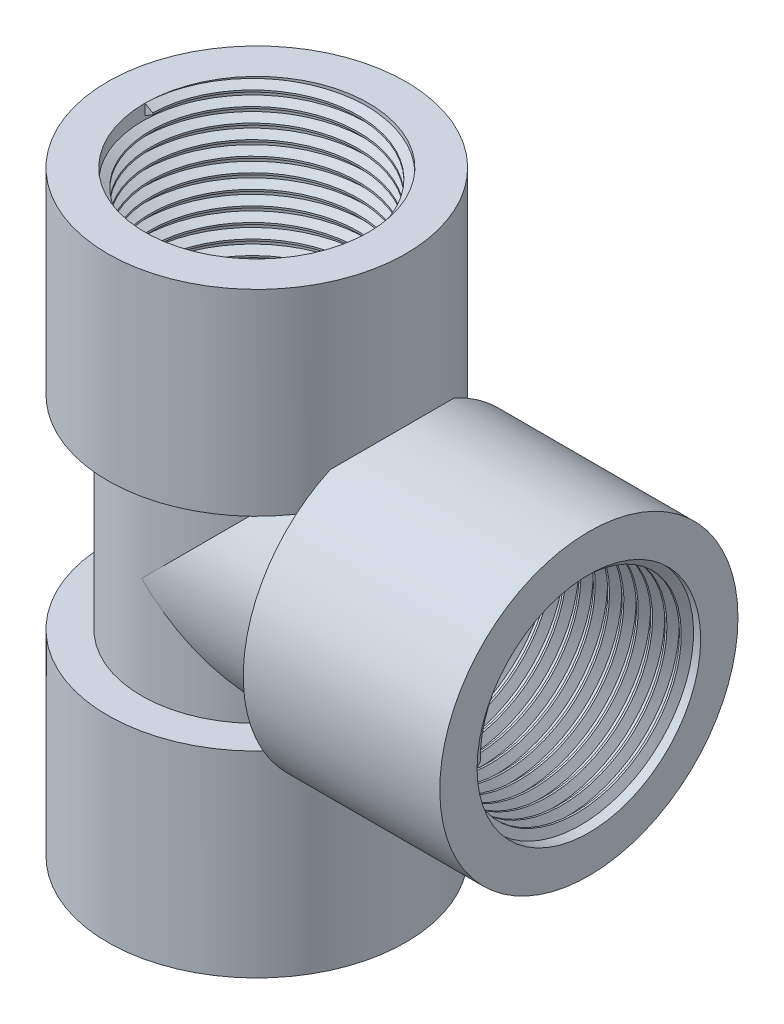
from build123d import *
from build123d.topology import SkipClean

# Parameters (mm, degrees)
SZKIC1_R                        = 17
SZKIC1_R_2                      = 12.5
DODANIE_WYCI_GNI_CIE1_DEPTH     = 30
SZKIC4_R                        = 17
SZKIC4_R_2                      = 12.5
DODANIE_WYCI_GNI_CIE3_DEPTH     = 20
WYTNIJ_WYCI_GNI_CIE1_DEPTH      = 20
WYTNIJ_WYCI_GNI_CIE1_DEPTH_BACK = 42.38840434
SZKIC5_R                        = 12.5
WYTNIJ_WYCI_GNI_CIE2_REACH      = 53.788
SZKIC6_R                        = 12.5
SZKIC7_R                        = 22
SZKIC7_R_2                      = 16.5
DODANIE_WYCI_GNI_CIE4_DEPTH     = 29
DODANIE_WYCI_GNI_CIE5_START     = 29
SZKIC8_R                        = 22
SZKIC8_R_2                      = 16.5
DODANIE_WYCI_GNI_CIE5_DEPTH     = 29
SZKIC9_R                        = 22
SZKIC9_R_2                      = 16.5
DODANIE_WYCI_GNI_CIE6_DEPTH     = 29
GWINT1_PITCH                    = 2.116666667
GWINT2_PITCH                    = 2.116666667
GWINT3_PITCH                    = 2.116666667


with BuildPart() as part:
    # Szkic1 → Dodanie-wyciągnięcie1 (new body)
    with BuildSketch(Plane(origin=(0, 0, 0), x_dir=(1, 0, 0), z_dir=(0, 1, 0))):
        with Locations(Location((0, 0, 0), (0, 0, 270))):
            Circle(SZKIC1_R)
        with Locations(Location((0, 0, 0), (0, 0, 270))):
            Circle(SZKIC1_R_2, mode=Mode.SUBTRACT)
    extrude(amount=DODANIE_WYCI_GNI_CIE1_DEPTH)

    # Szkic4 → Dodanie-wyciągnięcie3 (add)
    with BuildSketch(Plane(origin=(20, 0, 0), x_dir=(0, 0, -1), z_dir=(1, 0, 0))):
        with Locations((0, 15)):
            Circle(SZKIC4_R)
        with Locations((0, 15)):
            Circle(SZKIC4_R_2, mode=Mode.SUBTRACT)
    extrude(amount=-DODANIE_WYCI_GNI_CIE3_DEPTH)

    # Szkic5 → Wytnij-wyciągnięcie1 (cut, two sides: drawn at the far end of the back side and taken through both)
    with BuildSketch(Plane(origin=(0, 30, 0), x_dir=(1, 0, 0), z_dir=(0, 1, 0)).offset(-WYTNIJ_WYCI_GNI_CIE1_DEPTH_BACK)):
        with Locations(Location((0, 0, 0), (0, 0, 320.2081805))):
            Circle(SZKIC5_R)
    extrude(amount=WYTNIJ_WYCI_GNI_CIE1_DEPTH + WYTNIJ_WYCI_GNI_CIE1_DEPTH_BACK, mode=Mode.SUBTRACT)

    # Szkic6 → Wytnij-wyciągnięcie2 (cut, up to next)
    with BuildSketch(Plane(origin=(20, 0, 0), x_dir=(0, 0, -1), z_dir=(1, 0, 0)), mode=Mode.PRIVATE) as wytnij_wyci_gni_cie2_sk1:
        with Locations((0, 15)):
            Circle(SZKIC6_R)
    wytnij_wyci_gni_cie2_tool1 = extrude(wytnij_wyci_gni_cie2_sk1.sketch, amount=-WYTNIJ_WYCI_GNI_CIE2_REACH, mode=Mode.PRIVATE) & part.part
    add(wytnij_wyci_gni_cie2_tool1.solids().sort_by_distance((20, 15, 0))[0], mode=Mode.SUBTRACT)

    # Szkic7 → Dodanie-wyciągnięcie4 (add)
    with BuildSketch(Plane.XZ):
        with Locations(Location((0, 0, 0), (0, 0, 90))):
            Circle(SZKIC7_R)
        with Locations(Location((0, 0, 0), (0, 0, 29.002546027))):
            Circle(SZKIC7_R_2, mode=Mode.SUBTRACT)
    extrude(amount=DODANIE_WYCI_GNI_CIE4_DEPTH)

    # Szkic8 → Dodanie-wyciągnięcie5 (add)
    with BuildSketch(Plane(origin=(0, 30, 0), x_dir=(1, 0, 0), z_dir=(0, 1, 0)).offset(DODANIE_WYCI_GNI_CIE5_START)):
        with Locations(Location((0, 0, 0), (0, 0, 270))):
            Circle(SZKIC8_R)
        with Locations(Location((0, 0, 0), (0, 0, 330.997453973))):
            Circle(SZKIC8_R_2, mode=Mode.SUBTRACT)
    extrude(amount=-DODANIE_WYCI_GNI_CIE5_DEPTH)

    # Szkic9 → Dodanie-wyciągnięcie6 (add)
    with BuildSketch(Plane(origin=(20, 0, 0), x_dir=(0, 0, -1), z_dir=(1, 0, 0))):
        with Locations(Location((0, 15, 0), (0, 0, 245.380022671))):
            Circle(SZKIC9_R)
        with Locations(Location((0, 15, 0), (0, 0, 114.619977329))):
            Circle(SZKIC9_R_2, mode=Mode.SUBTRACT)
    extrude(amount=DODANIE_WYCI_GNI_CIE6_DEPTH)

    # Gwint1: arcs per turn and ends read off the stored shape
    # Gwint1: the profile of Profil gwintu1 profile screwed along a right-hand helix through 13.700787 turns, 10 arcs to a turn; built about Z, then put on its axis
    with SkipClean():  # the faces are left unmerged after this step: merging them gives an invalid solid
        gwint1_z = Axis((0, 0, 0), (0, 0, 1))
        gwint1_corners = [(16.5003, 0, -0.000173205), (15.354320565, 0, 0.66145833), (15.354320565, 0, 0.926041664), (16.5003, 0, 1.587673199)]
        with BuildLine(mode=Mode.PRIVATE) as gwint1_profile:
            Line(gwint1_corners[0], gwint1_corners[1])
            Line(gwint1_corners[1], gwint1_corners[2])
            Line(gwint1_corners[2], gwint1_corners[3])
            Line(gwint1_corners[3], gwint1_corners[0])
        gwint1_cap = Face(gwint1_profile.wire())
        gwint1_turn_angles = [0, 18, 36, 54, 72, 90, 108, 126, 144, 162, 180, 198, 216, 234, 252, 270, 288, 306, 324, 342, 360]
        gwint1_turn_weights = [1, 0.9510565162951535, 1, 0.9510565162951535, 1, 0.9510565162951535, 1, 0.9510565162951535, 1, 0.9510565162951535, 1, 0.9510565162951535, 1, 0.9510565162951535, 1, 0.9510565162951535, 1, 0.9510565162951535, 1, 0.9510565162951535, 1]
        gwint1_turn_rails = [Edge.make_bspline([Vector(p[0], p[1], 0).rotate(gwint1_z, gwint1_turn_angles[k]) / gwint1_turn_weights[k] + Vector(0, 0, p[2] + GWINT1_PITCH * gwint1_turn_angles[k] / 360) for k in range(21)], [0, 0, 0, 1, 1, 2, 2, 3, 3, 4, 4, 5, 5, 6, 6, 7, 7, 8, 8, 9, 9, 10, 10, 10], 2, gwint1_turn_weights) for p in gwint1_corners]
        gwint1_turn_sides = [Face.make_surface_from_curves(gwint1_turn_rails[p[0]], gwint1_turn_rails[p[1]]) for p in [(0, 1), (1, 2), (2, 3), (3, 0)]]
        gwint1_last_angles = [4680, 4698, 4716, 4734, 4752, 4770, 4788, 4806, 4824, 4842, 4860, 4878, 4896, 4914, 4932, 4932.141732283, 4932.283464567]
        gwint1_last_weights = [1, 0.9510565162951535, 1, 0.9510565162951535, 1, 0.9510565162951535, 1, 0.9510565162951535, 1, 0.9510565162951535, 1, 0.9510565162951535, 1, 0.9510565162951535, 1, 0.9999969404180766, 1]
        gwint1_last_rails = [Edge.make_bspline([Vector(p[0], p[1], 0).rotate(gwint1_z, gwint1_last_angles[k]) / gwint1_last_weights[k] + Vector(0, 0, p[2] + GWINT1_PITCH * gwint1_last_angles[k] / 360) for k in range(17)], [0, 0, 0, 1, 1, 2, 2, 3, 3, 4, 4, 5, 5, 6, 6, 7, 7, 8, 8, 8], 2, gwint1_last_weights) for p in gwint1_corners]
        gwint1_last_sides = [Face.make_surface_from_curves(gwint1_last_rails[p[0]], gwint1_last_rails[p[1]]) for p in [(0, 1), (1, 2), (2, 3), (3, 0)]]
        gwint1 = Plane(origin=(0, 59, 0), x_dir=(-1, 0, 0), z_dir=(0, -1, 0)) * Solid(Shell([*[p.moved(Location((0, 0, GWINT1_PITCH * i))) for i in range(13) for p in gwint1_turn_sides], *gwint1_last_sides, gwint1_cap, gwint1_cap.rotate(gwint1_z, 4932.283464567).moved(Location((0, 0, GWINT1_PITCH * 4932.283464567 / 360)))]))
        add(gwint1)

    # Gwint2: arcs per turn and ends read off the stored shape
    # Gwint2: the profile of Profil gwintu2 profile screwed along a right-hand helix through 13.700787 turns, 10 arcs to a turn; built about Z, then put on its axis
    with SkipClean():  # the faces are left unmerged after this step: merging them gives an invalid solid
        gwint2_z = Axis((0, 0, 0), (0, 0, 1))
        gwint2_corners = [(16.5003, 0, -0.000173205), (15.354320565, 0, 0.66145833), (15.354320565, 0, 0.926041664), (16.5003, 0, 1.587673199)]
        with BuildLine(mode=Mode.PRIVATE) as gwint2_profile:
            Line(gwint2_corners[0], gwint2_corners[1])
            Line(gwint2_corners[1], gwint2_corners[2])
            Line(gwint2_corners[2], gwint2_corners[3])
            Line(gwint2_corners[3], gwint2_corners[0])
        gwint2_cap = Face(gwint2_profile.wire())
        gwint2_turn_angles = [0, 18, 36, 54, 72, 90, 108, 126, 144, 162, 180, 198, 216, 234, 252, 270, 288, 306, 324, 342, 360]
        gwint2_turn_weights = [1, 0.9510565162951535, 1, 0.9510565162951535, 1, 0.9510565162951535, 1, 0.9510565162951535, 1, 0.9510565162951535, 1, 0.9510565162951535, 1, 0.9510565162951535, 1, 0.9510565162951535, 1, 0.9510565162951535, 1, 0.9510565162951535, 1]
        gwint2_turn_rails = [Edge.make_bspline([Vector(p[0], p[1], 0).rotate(gwint2_z, gwint2_turn_angles[k]) / gwint2_turn_weights[k] + Vector(0, 0, p[2] + GWINT2_PITCH * gwint2_turn_angles[k] / 360) for k in range(21)], [0, 0, 0, 1, 1, 2, 2, 3, 3, 4, 4, 5, 5, 6, 6, 7, 7, 8, 8, 9, 9, 10, 10, 10], 2, gwint2_turn_weights) for p in gwint2_corners]
        gwint2_turn_sides = [Face.make_surface_from_curves(gwint2_turn_rails[p[0]], gwint2_turn_rails[p[1]]) for p in [(0, 1), (1, 2), (2, 3), (3, 0)]]
        gwint2_last_angles = [4680, 4698, 4716, 4734, 4752, 4770, 4788, 4806, 4824, 4842, 4860, 4878, 4896, 4914, 4932, 4932.141732283, 4932.283464567]
        gwint2_last_weights = [1, 0.9510565162951535, 1, 0.9510565162951535, 1, 0.9510565162951535, 1, 0.9510565162951535, 1, 0.9510565162951535, 1, 0.9510565162951535, 1, 0.9510565162951535, 1, 0.9999969404180766, 1]
        gwint2_last_rails = [Edge.make_bspline([Vector(p[0], p[1], 0).rotate(gwint2_z, gwint2_last_angles[k]) / gwint2_last_weights[k] + Vector(0, 0, p[2] + GWINT2_PITCH * gwint2_last_angles[k] / 360) for k in range(17)], [0, 0, 0, 1, 1, 2, 2, 3, 3, 4, 4, 5, 5, 6, 6, 7, 7, 8, 8, 8], 2, gwint2_last_weights) for p in gwint2_corners]
        gwint2_last_sides = [Face.make_surface_from_curves(gwint2_last_rails[p[0]], gwint2_last_rails[p[1]]) for p in [(0, 1), (1, 2), (2, 3), (3, 0)]]
        gwint2 = Plane(origin=(0, -29, 0), x_dir=(1, 0, 0), z_dir=(0, 1, 0)) * Solid(Shell([*[p.moved(Location((0, 0, GWINT2_PITCH * i))) for i in range(13) for p in gwint2_turn_sides], *gwint2_last_sides, gwint2_cap, gwint2_cap.rotate(gwint2_z, 4932.283464567).moved(Location((0, 0, GWINT2_PITCH * 4932.283464567 / 360)))]))
        add(gwint2)

    # Gwint3: arcs per turn and ends read off the stored shape
    # Gwint3: the profile of Profil gwintu3 profile screwed along a right-hand helix through 13.700787 turns, 10 arcs to a turn; built about Z, then put on its axis
    with SkipClean():  # the faces are left unmerged after this step: merging them gives an invalid solid
        gwint3_z = Axis((0, 0, 0), (0, 0, 1))
        gwint3_corners = [(16.5003, 0, -0.000173205), (15.354320565, 0, 0.66145833), (15.354320565, 0, 0.926041664), (16.5003, 0, 1.587673199)]
        with BuildLine(mode=Mode.PRIVATE) as gwint3_profile:
            Line(gwint3_corners[0], gwint3_corners[1])
            Line(gwint3_corners[1], gwint3_corners[2])
            Line(gwint3_corners[2], gwint3_corners[3])
            Line(gwint3_corners[3], gwint3_corners[0])
        gwint3_cap = Face(gwint3_profile.wire())
        gwint3_turn_angles = [0, 18, 36, 54, 72, 90, 108, 126, 144, 162, 180, 198, 216, 234, 252, 270, 288, 306, 324, 342, 360]
        gwint3_turn_weights = [1, 0.9510565162951535, 1, 0.9510565162951535, 1, 0.9510565162951535, 1, 0.9510565162951535, 1, 0.9510565162951535, 1, 0.9510565162951535, 1, 0.9510565162951535, 1, 0.9510565162951535, 1, 0.9510565162951535, 1, 0.9510565162951535, 1]
        gwint3_turn_rails = [Edge.make_bspline([Vector(p[0], p[1], 0).rotate(gwint3_z, gwint3_turn_angles[k]) / gwint3_turn_weights[k] + Vector(0, 0, p[2] + GWINT3_PITCH * gwint3_turn_angles[k] / 360) for k in range(21)], [0, 0, 0, 1, 1, 2, 2, 3, 3, 4, 4, 5, 5, 6, 6, 7, 7, 8, 8, 9, 9, 10, 10, 10], 2, gwint3_turn_weights) for p in gwint3_corners]
        gwint3_turn_sides = [Face.make_surface_from_curves(gwint3_turn_rails[p[0]], gwint3_turn_rails[p[1]]) for p in [(0, 1), (1, 2), (2, 3), (3, 0)]]
        gwint3_turn = Solid(Shell([*gwint3_turn_sides, gwint3_cap, gwint3_cap.rotate(gwint3_z, 360).moved(Location((0, 0, GWINT3_PITCH * 360 / 360)))]))
        gwint3_last_angles = [4680, 4698, 4716, 4734, 4752, 4770, 4788, 4806, 4824, 4842, 4860, 4878, 4896, 4914, 4932, 4932.141732283, 4932.283464567]
        gwint3_last_weights = [1, 0.9510565162951535, 1, 0.9510565162951535, 1, 0.9510565162951535, 1, 0.9510565162951535, 1, 0.9510565162951535, 1, 0.9510565162951535, 1, 0.9510565162951535, 1, 0.9999969404180766, 1]
        gwint3_last_rails = [Edge.make_bspline([Vector(p[0], p[1], 0).rotate(gwint3_z, gwint3_last_angles[k]) / gwint3_last_weights[k] + Vector(0, 0, p[2] + GWINT3_PITCH * gwint3_last_angles[k] / 360) for k in range(17)], [0, 0, 0, 1, 1, 2, 2, 3, 3, 4, 4, 5, 5, 6, 6, 7, 7, 8, 8, 8], 2, gwint3_last_weights) for p in gwint3_corners]
        gwint3_last_sides = [Face.make_surface_from_curves(gwint3_last_rails[p[0]], gwint3_last_rails[p[1]]) for p in [(0, 1), (1, 2), (2, 3), (3, 0)]]
        gwint3_last = Solid(Shell([*gwint3_last_sides, gwint3_cap.rotate(gwint3_z, 4680).moved(Location((0, 0, GWINT3_PITCH * 4680 / 360))), gwint3_cap.rotate(gwint3_z, 4932.283464567).moved(Location((0, 0, GWINT3_PITCH * 4932.283464567 / 360)))]))
        gwint3_each = [*[gwint3_turn.moved(Location((0, 0, GWINT3_PITCH * i))) for i in range(13)], gwint3_last]
        add(Plane(origin=(49, 15, 0), x_dir=(0, 0, 1), z_dir=(-1, 0, 0)) * Compound([gwint3_each[i] for i in range(0, 14, 2)]))
        add(Plane(origin=(49, 15, 0), x_dir=(0, 0, 1), z_dir=(-1, 0, 0)) * Compound([gwint3_each[i] for i in range(1, 14, 2)]))


solid = part.part
